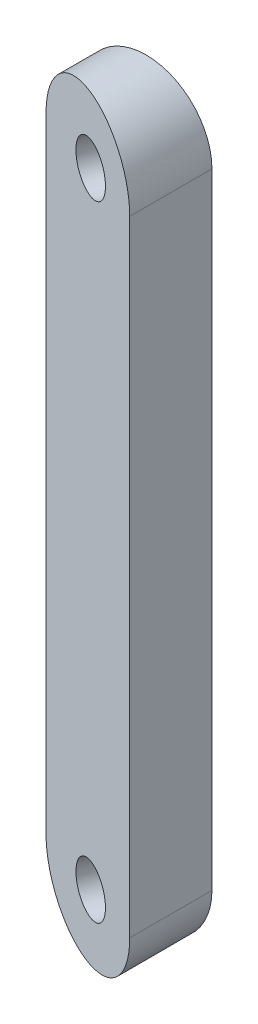
from build123d import *

# Parameters (mm, degrees)
BOSS_EXTRUDE1_DEPTH     = 5
CUT_EXTRUDE1_DEPTH      = 77.124744118
CUT_EXTRUDE1_DEPTH_BACK = 77.124744118
SKETCH3_R               = 1.5
CUT_EXTRUDE2_DEPTH      = 91


with BuildPart() as part:
    # Sketch1 → Boss-Extrude1 (new body)
    with BuildSketch(Plane.XY):
        with BuildLine():
            Line((72.394590039, 19), (72.394590039, -19))
            ThreePointArc((72.394590039, -19), (68.394590039, -23), (64.394590039, -19))
            Line((64.394590039, -19), (64.394590039, 19))
            ThreePointArc((64.394590039, 19), (68.394590039, 23), (72.394590039, 19))
        make_face()
    extrude(amount=BOSS_EXTRUDE1_DEPTH)

    # Sketch2 → Cut-Extrude1 (cut, two sides: drawn at the far end of the back side and taken through both)
    with BuildSketch(Plane(origin=(0, 0, 0), x_dir=(1, 0, 0), z_dir=(0, 1, 0)).offset(-CUT_EXTRUDE1_DEPTH_BACK)):
        Polygon((72.394590039, -5), (64.394590039, -2.088238126), (64.394590039, -5), align=None)
    extrude(amount=CUT_EXTRUDE1_DEPTH + CUT_EXTRUDE1_DEPTH_BACK, mode=Mode.SUBTRACT)

    # Sketch3 → Cut-Extrude2 (cut)
    with BuildSketch(Plane(origin=(6.86158929, 0, -18.852061635), x_dir=(0.939692620785907, 0, 0.3420201433256727), z_dir=(-0.3420201433256727, 0, 0.939692620785907))):
        with Locations((65.769891562, 19)):
            Circle(SKETCH3_R)
        with Locations((65.769891562, -19)):
            Circle(SKETCH3_R)
    extrude(amount=-CUT_EXTRUDE2_DEPTH, mode=Mode.SUBTRACT)


solid = part.part
